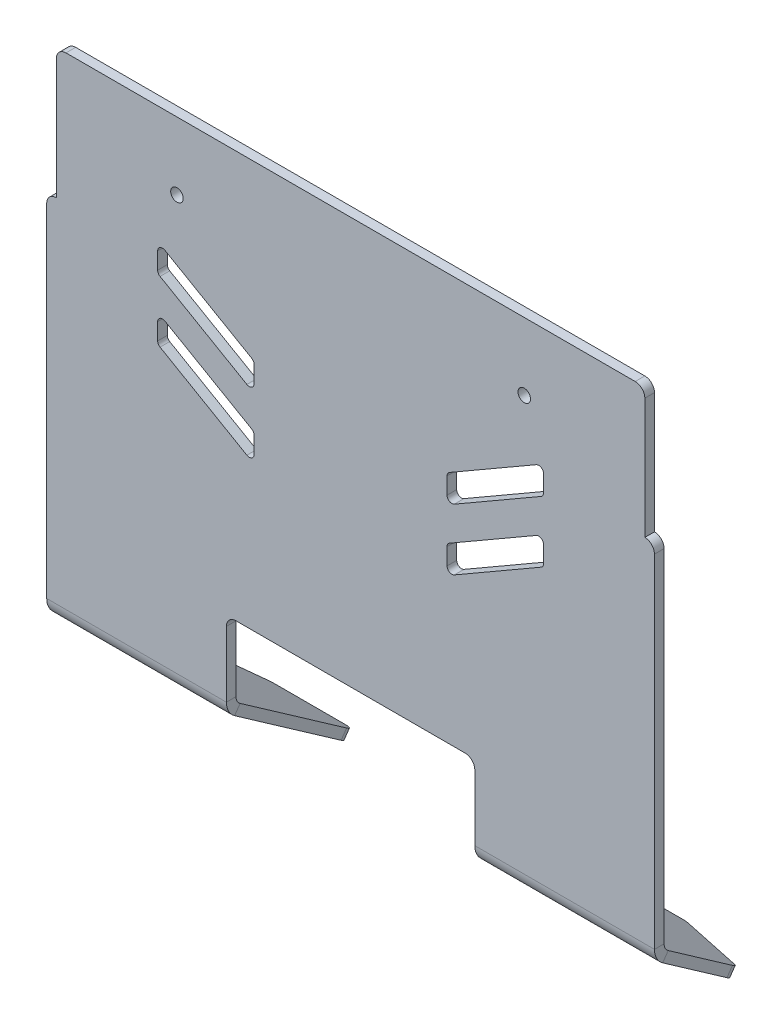
from build123d import *
from OCP.BRepFilletAPI import BRepFilletAPI_MakeChamfer

# Parameters (mm, degrees)
BASE_FLANGE1_DEPTH      = 63
CUT_EXTRUDE1_DEPTH      = 138.978891404
CUT_EXTRUDE1_DEPTH_BACK = 138.978891404
SKETCH2_W               = 51.5
SKETCH2_H               = 35.5
FILLET1_R               = 2
CHAMFER1_SIZE           = 20
CHAMFER1_SIZE2          = 11.547005384
SKETCH3_R               = 1.3
CUT_EXTRUDE2_DEPTH      = 2
SKETCH4_W               = 2
SKETCH4_H               = 27
CUT_EXTRUDE3_DEPTH      = 2
FILLET2_R               = 2
CUT_EXTRUDE4_DEPTH      = 10
FILLET3_R               = 1


# Sheet-metal steps are written as plain solids
with BuildPart() as part:
    # Sketch1 → Base-Flange1 (new, symmetric)
    with BuildSketch(Plane(origin=(0, 0, 0), x_dir=(0, 0, -1), z_dir=(1, 0, 0))):
        with BuildLine():
            Line((0, 0), (0, -99.958865899))
            ThreePointArc((0, -99.958865899), (0.225978334, -100.882363125), (0.852847127, -101.597169987))
            Line((0.852847127, -101.597169987), (24.574561329, -118.207293091))
            Line((24.574561329, -118.207293091), (23.427408456, -119.845597179))
            Line((23.427408456, -119.845597179), (-0.294305745, -103.235474076))
            ThreePointArc((-0.294305745, -103.235474076), (-1.548043333, -101.805860352), (-2, -99.958865899))
            Line((-2, -99.958865899), (-2, 0))
            Line((-2, 0), (0, 0))
        make_face()
    extrude(amount=BASE_FLANGE1_DEPTH, both=True)

    # Sketch2 → Cut-Extrude1 (cut, two sides: drawn at the far end of the back side and taken through both)
    with BuildSketch(Plane.XY.offset(2).offset(-CUT_EXTRUDE1_DEPTH_BACK)):
        with Locations((0, -102.095597179)):
            Rectangle(SKETCH2_W, SKETCH2_H)
    extrude(amount=CUT_EXTRUDE1_DEPTH + CUT_EXTRUDE1_DEPTH_BACK, mode=Mode.SUBTRACT)

    # Fillet1
    fillet1_edges = [part.edges().sort_by_distance(p)[0] for p in [
        (-25.75, -84.345597179, 1),
        (25.75, -84.345597179, 1),
    ]]
    fillet(fillet1_edges, radius=FILLET1_R)

    # Chamfer1: one chamfer whose edges measure the first distance from different faces: ONE call of the kernel's chamfer builder (chamfer() names one face for all edges)
    chamfer1_edges_1 = [part.edges().sort_by_distance(p)[0] for p in [
        (63, -119.026445135, -24.000984892),
    ]]
    chamfer1_side_1 = [part.faces().sort_by_distance(p)[0] for p in [
        (44.375, -119.026445135, -24.000984892),
    ]]
    chamfer1_edges_2 = [part.edges().sort_by_distance(p)[0] for p in [
        (-63, -119.026445135, -24.000984892),
    ]]
    chamfer1_side_2 = [part.faces().sort_by_distance(p)[0] for p in [
        (-44.375, -119.026445135, -24.000984892),
    ]]
    chamfer1 = BRepFilletAPI_MakeChamfer(part.part.solid().wrapped)
    for e in chamfer1_edges_1:
        chamfer1.Add(CHAMFER1_SIZE, CHAMFER1_SIZE2, e.wrapped, chamfer1_side_1[0].wrapped)  # the first distance lies on this face
    for e in chamfer1_edges_2:
        chamfer1.Add(CHAMFER1_SIZE, CHAMFER1_SIZE2, e.wrapped, chamfer1_side_2[0].wrapped)  # the first distance lies on this face
    add(Compound.cast(chamfer1.Shape()), mode=Mode.REPLACE)

    # Sketch3 → Cut-Extrude2 (cut)
    with BuildSketch(Plane.XY.offset(2)):
        with Locations((-36, -14)):
            Circle(SKETCH3_R)
        with Locations((36, -14)):
            Circle(SKETCH3_R)
    extrude(amount=-CUT_EXTRUDE2_DEPTH, mode=Mode.SUBTRACT)

    # Sketch4 → Cut-Extrude3 (cut)
    with BuildSketch(Plane.XY.offset(2)):
        with Locations((-62, -13.5)):
            Rectangle(SKETCH4_W, SKETCH4_H)
        with Locations((62, -13.5)):
            Rectangle(SKETCH4_W, SKETCH4_H)
    extrude(amount=-CUT_EXTRUDE3_DEPTH, mode=Mode.SUBTRACT)

    # Fillet2
    fillet2_edges = [part.edges().sort_by_distance(p)[0] for p in [
        (63, -112.403354936, -14.542231827),
        (43, -119.026445135, -24.000984892),
        (25.75, -119.026445135, -24.000984892),
        (-63, -112.403354936, -14.542231827),
        (-43, -119.026445135, -24.000984892),
        (-25.75, -119.026445135, -24.000984892),
        (-63, -27, 1),
        (63, -27, 1),
        (61, 0, 1),
        (-61, 0, 1),
    ]]
    fillet(fillet2_edges, radius=FILLET2_R - 0.0001)  # a hair under: the kernel refuses the full size

    # Sketch5 → Cut-Extrude4 (cut)
    with BuildSketch(Plane.XY.offset(2)):
        Polygon((-40, -24.323383181), (-40, -30.096885873), (-20, -41.643891257), (-20, -35.870388565), align=None)
        Polygon((-40, -37.025089103), (-20, -48.572094487), (-20, -54.345597179), (-40, -42.798591795), align=None)
        Polygon((40, -42.798591795), (40, -37.025089103), (20, -48.572094487), (20, -54.345597179), align=None)
        Polygon((20, -35.870388565), (40, -24.323383181), (40, -30.096885873), (20, -41.643891257), align=None)
    extrude(amount=-CUT_EXTRUDE4_DEPTH, mode=Mode.SUBTRACT)

    # Fillet3
    fillet3_edges = [part.edges().sort_by_distance(p)[0] for p in [
        (-40, -42.798591795, 1),
        (-40, -37.025089103, 1),
        (-20, -48.572094487, 1),
        (-20, -54.345597179, 1),
        (40, -42.798591795, 1),
        (20, -54.345597179, 1),
        (20, -48.572094487, 1),
        (40, -37.025089103, 1),
        (20, -41.643891257, 1),
        (20, -35.870388565, 1),
        (40, -24.323383181, 1),
        (40, -30.096885873, 1),
        (-40, -24.323383181, 1),
        (-20, -35.870388565, 1),
        (-20, -41.643891257, 1),
        (-40, -30.096885873, 1),
    ]]
    fillet(fillet3_edges, radius=FILLET3_R)


solid = part.part
